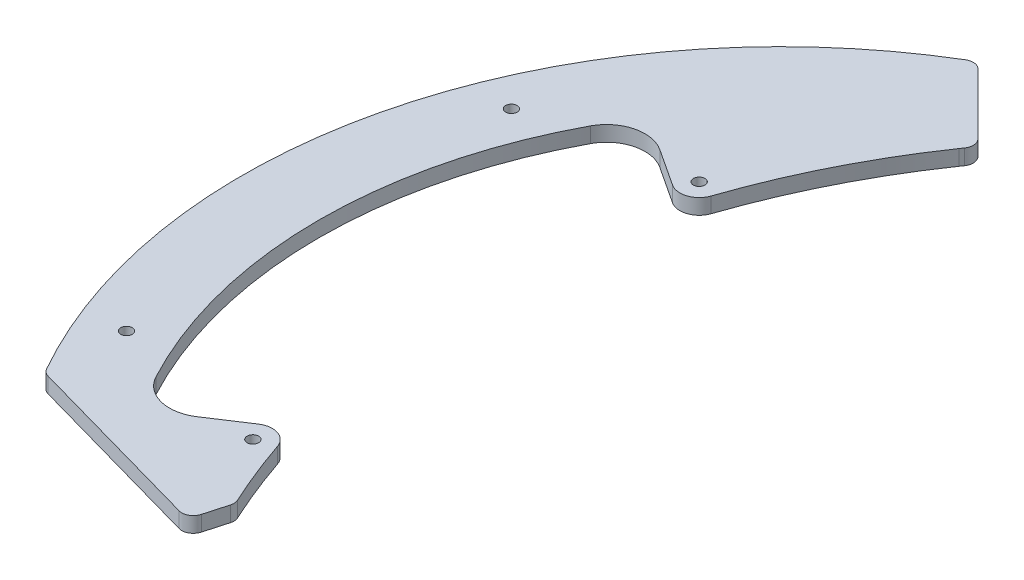
from build123d import *

# Parameters (mm, degrees)
SKETCH1_R               = 140
BOSS_EXTRUDE1_DEPTH     = 4
CUT_EXTRUDE1_REACH      = 200.03
CUT_EXTRUDE3_REACH      = 200.03
SKETCH19_R              = 1.5
CUT_EXTRUDE4_REACH      = 200.03
FILLET2_R               = 10
CUT_EXTRUDE8_DEPTH      = 186.245782678
CUT_EXTRUDE8_DEPTH_BACK = 186.245782678
CUT_EXTRUDE9_REACH      = 187.246
FILLET4_R               = 5
FILLET6_R               = 10
CUT_EXTRUDE10_REACH     = 187.246
SKETCH25_R              = 1.5
FILLET5_R               = 3


with BuildPart() as part:
    # Sketch1 → Boss-Extrude1 (new body)
    with BuildSketch(Plane(origin=(0, 0, 0), x_dir=(1, 0, 0), z_dir=(0, 1, 0))):
        Circle(SKETCH1_R)
    extrude(amount=BOSS_EXTRUDE1_DEPTH)

    # Sketch17 → Cut-Extrude1 (cut, up to next)
    with BuildSketch(Plane.XZ, mode=Mode.PRIVATE) as cut_extrude1_sk1:
        Polygon((-50, 90), (-121.24355653, 70), (-121.24355653, 140), (121.24355653, 140), (121.24355653, 70), (50, 90), align=None)
    cut_extrude1_tool1 = extrude(cut_extrude1_sk1.sketch, amount=-CUT_EXTRUDE1_REACH, mode=Mode.PRIVATE) & part.part
    add(cut_extrude1_tool1.solids().sort_by_distance((0, 0, 111.669853))[0], mode=Mode.SUBTRACT)

    # Sketch19 → Cut-Extrude3 (cut, up to next)
    with BuildSketch(Plane(origin=(0, 4, 0), x_dir=(1, 0, 0), z_dir=(0, 1, 0)), mode=Mode.PRIVATE) as cut_extrude3_sk1:
        with Locations((-79.195959493, -57.982756057)):
            Circle(SKETCH19_R)
    cut_extrude3_tool1 = extrude(cut_extrude3_sk1.sketch, amount=-CUT_EXTRUDE3_REACH, mode=Mode.PRIVATE) & part.part
    # Sketch19 → Cut-Extrude3 (cut, up to next)
    with BuildSketch(Plane(origin=(0, 4, 0), x_dir=(1, 0, 0), z_dir=(0, 1, 0)), mode=Mode.PRIVATE) as cut_extrude3_sk2:
        with Locations((-79.195959493, 57.982756057)):
            Circle(SKETCH19_R)
    cut_extrude3_tool2 = extrude(cut_extrude3_sk2.sketch, amount=-CUT_EXTRUDE3_REACH, mode=Mode.PRIVATE) & part.part
    # Sketch19 → Cut-Extrude3 (cut, up to next)
    with BuildSketch(Plane(origin=(0, 4, 0), x_dir=(1, 0, 0), z_dir=(0, 1, 0)), mode=Mode.PRIVATE) as cut_extrude3_sk3:
        with Locations((79.195959493, 57.982756057)):
            Circle(SKETCH19_R)
    cut_extrude3_tool3 = extrude(cut_extrude3_sk3.sketch, amount=-CUT_EXTRUDE3_REACH, mode=Mode.PRIVATE) & part.part
    # Sketch19 → Cut-Extrude3 (cut, up to next)
    with BuildSketch(Plane(origin=(0, 4, 0), x_dir=(1, 0, 0), z_dir=(0, 1, 0)), mode=Mode.PRIVATE) as cut_extrude3_sk4:
        with Locations((79.195959493, -57.982756057)):
            Circle(SKETCH19_R)
    cut_extrude3_tool4 = extrude(cut_extrude3_sk4.sketch, amount=-CUT_EXTRUDE3_REACH, mode=Mode.PRIVATE) & part.part
    # Sketch19 → Cut-Extrude3 (cut, up to next)
    with BuildSketch(Plane(origin=(0, 4, 0), x_dir=(1, 0, 0), z_dir=(0, 1, 0)), mode=Mode.PRIVATE) as cut_extrude3_sk5:
        with Locations((-57.982756057, 79.195959493)):
            Circle(SKETCH19_R)
    cut_extrude3_tool5 = extrude(cut_extrude3_sk5.sketch, amount=-CUT_EXTRUDE3_REACH, mode=Mode.PRIVATE) & part.part
    # Sketch19 → Cut-Extrude3 (cut, up to next)
    with BuildSketch(Plane(origin=(0, 4, 0), x_dir=(1, 0, 0), z_dir=(0, 1, 0)), mode=Mode.PRIVATE) as cut_extrude3_sk6:
        with Locations((57.982756057, 79.195959493)):
            Circle(SKETCH19_R)
    cut_extrude3_tool6 = extrude(cut_extrude3_sk6.sketch, amount=-CUT_EXTRUDE3_REACH, mode=Mode.PRIVATE) & part.part
    # Sketch19 → Cut-Extrude3 (cut, up to next)
    with BuildSketch(Plane(origin=(0, 4, 0), x_dir=(1, 0, 0), z_dir=(0, 1, 0)), mode=Mode.PRIVATE) as cut_extrude3_sk7:
        with Locations((57.982756057, -79.195959493)):
            Circle(SKETCH19_R)
    cut_extrude3_tool7 = extrude(cut_extrude3_sk7.sketch, amount=-CUT_EXTRUDE3_REACH, mode=Mode.PRIVATE) & part.part
    # Sketch19 → Cut-Extrude3 (cut, up to next)
    with BuildSketch(Plane(origin=(0, 4, 0), x_dir=(1, 0, 0), z_dir=(0, 1, 0)), mode=Mode.PRIVATE) as cut_extrude3_sk8:
        with Locations((-57.982756057, -79.195959493)):
            Circle(SKETCH19_R)
    cut_extrude3_tool8 = extrude(cut_extrude3_sk8.sketch, amount=-CUT_EXTRUDE3_REACH, mode=Mode.PRIVATE) & part.part
    add(cut_extrude3_tool1.solids().sort_by_distance((-79.195959, 4, 57.982756))[0], mode=Mode.SUBTRACT)
    add(cut_extrude3_tool2.solids().sort_by_distance((-79.195959, 4, -57.982756))[0], mode=Mode.SUBTRACT)
    add(cut_extrude3_tool3.solids().sort_by_distance((79.195959, 4, -57.982756))[0], mode=Mode.SUBTRACT)
    add(cut_extrude3_tool4.solids().sort_by_distance((79.195959, 4, 57.982756))[0], mode=Mode.SUBTRACT)
    add(cut_extrude3_tool5.solids().sort_by_distance((-57.982756, 4, -79.195959))[0], mode=Mode.SUBTRACT)
    add(cut_extrude3_tool6.solids().sort_by_distance((57.982756, 4, -79.195959))[0], mode=Mode.SUBTRACT)
    add(cut_extrude3_tool7.solids().sort_by_distance((57.982756, 4, 79.195959))[0], mode=Mode.SUBTRACT)
    add(cut_extrude3_tool8.solids().sort_by_distance((-57.982756, 4, 79.195959))[0], mode=Mode.SUBTRACT)

    # Sketch20 → Cut-Extrude4 (cut, up to next)
    with BuildSketch(Plane(origin=(0, 4, 0), x_dir=(1, 0, 0), z_dir=(0, 1, 0)), mode=Mode.PRIVATE) as cut_extrude4_sk1:
        Polygon((-498.316459894, 549.560016424), (-70, 121.24355653), (-50, 101.24355653), (50, 101.24355653), (70, 121.24355653), (498.316459894, 549.560016424), (498.316459894, 1761.021909565), (-498.316459894, 1761.021909565), align=None)
    cut_extrude4_tool1 = extrude(cut_extrude4_sk1.sketch, amount=-CUT_EXTRUDE4_REACH, mode=Mode.PRIVATE) & part.part
    add(cut_extrude4_tool1.solids().sort_by_distance((0, 4, -1025.243605))[0], mode=Mode.SUBTRACT)

    # Fillet2
    fillet2_edges = [part.edges().sort_by_distance(p)[0] for p in [
        (50, 2, -101.24355653),
        (-50, 2, -101.24355653),
    ]]
    fillet(fillet2_edges, radius=FILLET2_R)

    # Sketch23 → Cut-Extrude8 (cut, two sides: drawn at the far end of the back side and taken through both)
    with BuildSketch(Plane(origin=(0, 4, 0), x_dir=(1, 0, 0), z_dir=(0, 1, 0)).offset(-CUT_EXTRUDE8_DEPTH_BACK)):
        with BuildLine():
            Line((-490.823111881, 542.066668411), (-52.928932188, 104.172488718))
            Line((-52.928932188, 104.172488718), (-50.874290482, 102.117847012))
            ThreePointArc((-50.874290482, 102.117847012), (-51.909066457, 100.662145618), (-52.928932188, 99.195959493))
            ThreePointArc((-52.928932188, 99.195959493), (-83.181550709, 14.19652015), (-67.072474501, -74.576354534))
            Line((-67.072474501, -74.576354534), (-73.189737717, -96.367133919))
            Line((-73.189737717, -96.367133919), (-240.56703475, -692.594830068))
            Line((-240.56703475, -692.594830068), (973.300414837, -446.553541452))
            Line((973.300414837, -446.553541452), (723.044337706, 788.107957027))
            Line((723.044337706, 788.107957027), (-490.823111881, 542.066668411))
        make_face()
    extrude(amount=CUT_EXTRUDE8_DEPTH + CUT_EXTRUDE8_DEPTH_BACK, mode=Mode.SUBTRACT)

    # Sketch24 → Cut-Extrude9 (cut, up to next)
    with BuildSketch(Plane(origin=(0, 4, 0), x_dir=(1, 0, 0), z_dir=(0, 1, 0)), mode=Mode.PRIVATE) as cut_extrude9_sk1:
        with BuildLine():
            Line((0, 0), (-100.308962252, 65.864346136))
            ThreePointArc((-100.308962252, 65.864346136), (-120, 0), (-100.308962252, -65.864346136))
            Line((-100.308962252, -65.864346136), (0, 0))
        make_face()
    cut_extrude9_tool1 = extrude(cut_extrude9_sk1.sketch, amount=-CUT_EXTRUDE9_REACH, mode=Mode.PRIVATE) & part.part
    add(cut_extrude9_tool1.solids().sort_by_distance((-75.574375, 4, 0))[0], mode=Mode.SUBTRACT)

    # Fillet4
    fillet4_edges = [part.edges().sort_by_distance(p)[0] for p in [
        (-76.411733814, 2, 50.173072992),
        (-76.411733814, 2, -50.173072992),
    ]]
    fillet(fillet4_edges, radius=FILLET4_R)

    # Fillet6
    fillet6_edges = [part.edges().sort_by_distance(p)[0] for p in [
        (-100.308962252, 2, -65.864346136),
        (-100.308962252, 2, 65.864346136),
    ]]
    fillet(fillet6_edges, radius=FILLET6_R)

    # Sketch25 → Cut-Extrude10 (cut, up to next)
    with BuildSketch(Plane(origin=(0, 4, 0), x_dir=(1, 0, 0), z_dir=(0, 1, 0)), mode=Mode.PRIVATE) as cut_extrude10_sk1:
        with Locations((-120, 50)):
            Circle(SKETCH25_R)
    cut_extrude10_tool1 = extrude(cut_extrude10_sk1.sketch, amount=-CUT_EXTRUDE10_REACH, mode=Mode.PRIVATE) & part.part
    # Sketch25 → Cut-Extrude10 (cut, up to next)
    with BuildSketch(Plane(origin=(0, 4, 0), x_dir=(1, 0, 0), z_dir=(0, 1, 0)), mode=Mode.PRIVATE) as cut_extrude10_sk2:
        with Locations((-120, -50)):
            Circle(SKETCH25_R)
    cut_extrude10_tool2 = extrude(cut_extrude10_sk2.sketch, amount=-CUT_EXTRUDE10_REACH, mode=Mode.PRIVATE) & part.part
    add(cut_extrude10_tool1.solids().sort_by_distance((-120, 4, -50))[0], mode=Mode.SUBTRACT)
    add(cut_extrude10_tool2.solids().sort_by_distance((-120, 4, 50))[0], mode=Mode.SUBTRACT)

    # Fillet5
    fillet5_edges = [part.edges().sort_by_distance(p)[0] for p in [
        (-70, 2, -121.24355653),
        (-50.874290482, 2, -102.117847012),
        (-67.072474501, 2, 74.576354534),
        (-69.838855295, 2, 84.430694855),
        (-121.24355653, 2, 70),
    ]]
    fillet(fillet5_edges, radius=FILLET5_R)


solid = part.part
